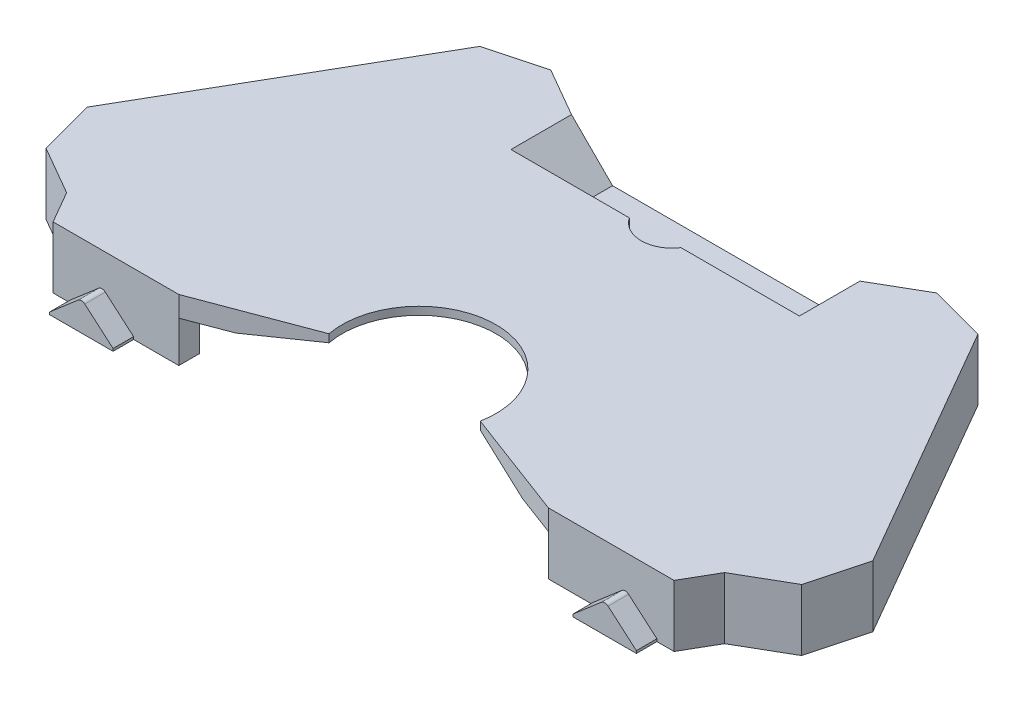
from build123d import *

# Parameters (mm, degrees)
BOSS_EXTRUDE6_DEPTH   = 2
BOSS_EXTRUDE6_2_DEPTH = 2
BOSS_EXTRUDE7_DEPTH   = 4
SKETCH15_W            = 28.094808214
SKETCH15_H            = 7.894882233
SKETCH15_R            = 1.75
BOSS_EXTRUDE8_DEPTH   = 2
BOSS_EXTRUDE9_DEPTH   = 2
FILLET3_R             = 0.5
FILLET3_OF_MIRROR2_R  = 0.5
BOSS_EXTRUDE10_DEPTH  = 2
BOSS_EXTRUDE11_DEPTH  = 4
CHAMFER2_SIZE         = 4
FILLET4_R             = 2
CHAMFER3_SIZE         = 7
CHAMFER3_SIZE2        = 1.234288865


# Some blends are built 0.0001 mm under size
with BuildPart() as part:
    # Sketch13 → Boss-Extrude6 (new body)
    with BuildSketch(Plane(origin=(0, 0, 0), x_dir=(1, 0, 0), z_dir=(0, 1, 0))):
        Polygon((-18, 21), (-14.047404107, 21), (-14.047404107, 28.894882233), (-18.803847577, 31.641016151), (-24.267949192, 30.176914536), (-38.267949192, 5.92820323), (-36.803847577, 0.464101615), (-32.047404107, -2.282032303), (-30.244289874, -5.405117767), (-30.12881982, -5.405117767), (-20, -5.405117767), (-18, -5.405117767), align=None)
    extrude(amount=BOSS_EXTRUDE6_DEPTH)



with BuildPart() as body_2:
    # Sketch13 → Boss-Extrude6 2 (new body)
    with BuildSketch(Plane(origin=(0, 0, 0), x_dir=(1, 0, 0), z_dir=(0, 1, 0))):
        Polygon((18, -5.405117767), (18, 21), (14.047404107, 21), (14.047404107, 28.894882233), (18.803847577, 31.641016151), (24.267949192, 30.176914536), (38.267949192, 5.92820323), (36.803847577, 0.464101615), (32.047404107, -2.282032303), (30.244289874, -5.405117767), (30.12881982, -5.405117767), (26.664718205, -5.405117767), (20, -5.405117767), align=None)
    extrude(amount=BOSS_EXTRUDE6_2_DEPTH)


with BuildPart() as part_1:
    add(part.part)

    add(body_2.part)  # Boss-Extrude7 merges body 2
    # Sketch14 → Boss-Extrude7 (add)
    with BuildSketch(Plane.XZ):
        Polygon((-30.244289874, 5.405117767), (-18, 5.405117767), (-18, 3.405117767), (-29.089589336, 3.405117767), (-30.583302492, 0.817930688), (-35.086408642, -1.78193886), (-36.121684822, -5.645642165), (-22.950111947, -28.459475601), (-19.086408642, -29.494751781), (-16.047404107, -27.740181695), (-16.047404107, -23), (-18, -23), (-18, -21), (-14.047404107, -21), (-14.047404107, -28.894882233), (-18.803847577, -31.641016151), (-24.267949192, -30.176914536), (-38.267949192, -5.92820323), (-36.803847577, -0.464101615), (-32.047404107, 2.282032303), align=None)
        Polygon((14.047404107, -21), (18, -21), (18, -23), (16.047404107, -23), (16.047404107, -27.740181695), (19.086408642, -29.494751781), (22.950111947, -28.459475601), (36.121684822, -5.645642165), (35.086408642, -1.78193886), (30.583302492, 0.817930688), (29.089589336, 3.405117767), (18, 3.405117767), (18, 5.405117767), (30.244289874, 5.405117767), (32.047404107, 2.282032303), (36.803847577, -0.464101615), (38.267949192, -5.92820323), (24.267949192, -30.176914536), (18.803847577, -31.641016151), (14.047404107, -28.894882233), align=None)
    extrude(amount=BOSS_EXTRUDE7_DEPTH)

    # Sketch15 → Boss-Extrude8 (add)
    with BuildSketch(Plane.XZ.offset(4)):
        with Locations((0, -24.947441117)):
            Rectangle(SKETCH15_W, SKETCH15_H)
        with Locations(Location((0, -24.644882233, 0), (0, 0, 270))):
            Circle(SKETCH15_R, mode=Mode.SUBTRACT)
    extrude(amount=-BOSS_EXTRUDE8_DEPTH)

    # Sketch16 → Boss-Extrude9 (add)
    with BuildSketch(Plane.XY.offset(5.405117767)):
        Polygon((-28.574119282, -3.76), (-28.574119282, -4), (-22.4, -4), (-22.4, -3.76), (-25.487059641, -1.104129474), align=None)
    boss_extrude9 = extrude(amount=BOSS_EXTRUDE9_DEPTH)

    # Fillet3
    fillet3_edges = [part_1.edges().sort_by_distance(p)[0] for p in [
        (-25.487059641, -1.104129474, 6.405117767),
    ]]
    fillet(fillet3_edges, radius=FILLET3_R)

    # Mirror2: Boss-Extrude9 across plane
    add(boss_extrude9.mirror(Plane(origin=(0, 0, 0), x_dir=(0, 0, 1), z_dir=(1, 0, 0))))

    # Fillet3 of Mirror2
    fillet3_of_mirror2_edges = [part_1.edges().sort_by_distance(p)[0] for p in [
        (25.487059641, -1.104129474, 6.405117767),
    ]]
    fillet(fillet3_of_mirror2_edges, radius=FILLET3_OF_MIRROR2_R)

    # Sketch17 → Boss-Extrude10 (add)
    with BuildSketch(Plane(origin=(0, 2, 0), x_dir=(1, 0, 0), z_dir=(0, 1, 0))):
        with BuildLine():
            Line((-18, -5.405117767), (-7.367200558, -1.405117767))
            ThreePointArc((-7.367200558, -1.405117767), (0, 7.5), (7.367200558, -1.405117767))
            Line((7.367200558, -1.405117767), (18, -5.405117767))
            Line((18, -5.405117767), (18, 21))
            Line((18, 21), (-18, 21))
            Line((-18, 21), (-18, -5.405117767))
        make_face()
    extrude(amount=-BOSS_EXTRUDE10_DEPTH)

    # Sketch18 → Boss-Extrude11 (add)
    with BuildSketch(Plane(origin=(0, -2, 0), x_dir=(1, 0, 0), z_dir=(0, 1, 0))):
        with BuildLine():
            Line((14.047404107, 21), (-14.047404107, 21))
            Line((-14.047404107, 21), (-14.047404107, 23))
            Line((-14.047404107, 23), (-2.508856799, 23))
            ThreePointArc((-2.508856799, 23), (0, 21.644882233), (2.508856799, 23))
            Line((2.508856799, 23), (14.047404107, 23))
            Line((14.047404107, 23), (14.047404107, 21))
        make_face()
    extrude(amount=BOSS_EXTRUDE11_DEPTH)

    # Chamfer2
    chamfer2_edges = [part_1.edges().sort_by_distance(p)[0] for p in [
        (14.047404107, -2, -25.947441117),
        (-14.047404107, -2, -25.947441117),
    ]]
    chamfer(chamfer2_edges, length=CHAMFER2_SIZE - 0.0001)  # a hair under: the kernel refuses the full size

    # Fillet4
    # the kernel refuses this fillet: 2 mm, written as the material it adds along each edge
    with BuildSketch(Plane(origin=(29.089589336, 2.886751346, 3.405117767), x_dir=(0.4999999999999999, 0, -0.8660254037844386), z_dir=(0, -1, 0))) as fillet4_piece_1_section:
        with BuildLine():
            CenterArc((FILLET4_R * 0.57735026919, -FILLET4_R), FILLET4_R, 90, 60)
            Line((-FILLET4_R * 0.288675134595, -FILLET4_R * 0.5), (0, 0))
            Line((0, 0), (FILLET4_R * 0.57735026919, 0))
        make_face()
    fillet4_piece_1 = extrude(amount=6.886751346, mode=Mode.PRIVATE)
    fillet4_piece_1 = split(fillet4_piece_1, bisect_by=Plane(origin=(28.968451808, 2, 3.195301414), z_dir=(0, -1, 0)), keep=Keep.TOP, mode=Mode.PRIVATE)
    add(fillet4_piece_1)
    with BuildSketch(Plane(origin=(-29.089589336, 2.886751346, 3.405117767), x_dir=(1, 0, 0), z_dir=(0, -1, 0))) as fillet4_piece_2_section:
        with BuildLine():
            CenterArc((FILLET4_R * 0.57735026919, -FILLET4_R), FILLET4_R, 90, 60)
            Line((-FILLET4_R * 0.288675134595, -FILLET4_R * 0.5), (0, 0))
            Line((0, 0), (FILLET4_R * 0.57735026919, 0))
        make_face()
    fillet4_piece_2 = extrude(amount=6.886751346, mode=Mode.PRIVATE)
    fillet4_piece_2 = split(fillet4_piece_2, bisect_by=Plane(origin=(-28.968451808, 2, 3.195301414), z_dir=(0, -1, 0)), keep=Keep.TOP, mode=Mode.PRIVATE)
    add(fillet4_piece_2)
    with BuildSketch(Plane(origin=(22.950111947, 2.071067812, -28.459475601), x_dir=(-0.9659258262890683, 0, -0.2588190451025206), z_dir=(0, -1, 0))) as fillet4_piece_3_section:
        with BuildLine():
            CenterArc((FILLET4_R * 0.414213562373, -FILLET4_R), FILLET4_R, 90, 45)
            Line((-FILLET4_R * 0.292893218813, -FILLET4_R * 0.292893218813), (0, 0))
            Line((0, 0), (FILLET4_R * 0.414213562373, 0))
        make_face()
    fillet4_piece_3 = extrude(amount=6.071067812, mode=Mode.PRIVATE)
    fillet4_piece_3 = split(fillet4_piece_3, bisect_by=Plane(origin=(22.870823982, 2, -28.356145514), z_dir=(0, -1, 0)), keep=Keep.TOP, mode=Mode.PRIVATE)
    add(fillet4_piece_3)
    with BuildSketch(Plane(origin=(19.086408642, 2.071067812, -29.494751781), x_dir=(-0.8660254037844382, 0, 0.500000000000001), z_dir=(0, -1, 0))) as fillet4_piece_4_section:
        with BuildLine():
            CenterArc((FILLET4_R * 0.414213562373, -FILLET4_R), FILLET4_R, 90, 45)
            Line((-FILLET4_R * 0.292893218813, -FILLET4_R * 0.292893218813), (0, 0))
            Line((0, 0), (FILLET4_R * 0.414213562373, 0))
        make_face()
    fillet4_piece_4 = extrude(amount=6.071067812, mode=Mode.PRIVATE)
    fillet4_piece_4 = split(fillet4_piece_4, bisect_by=Plane(origin=(19.10340899, 2, -29.365621318), z_dir=(0, -1, 0)), keep=Keep.TOP, mode=Mode.PRIVATE)
    add(fillet4_piece_4)
    with BuildSketch(Plane(origin=(16.047404107, 2.886751346, -27.740181695), x_dir=(0, 0, 1), z_dir=(0, -1, 0))) as fillet4_piece_5_section:
        with BuildLine():
            CenterArc((FILLET4_R * 0.57735026919, -FILLET4_R), FILLET4_R, 90, 60)
            Line((-FILLET4_R * 0.288675134595, -FILLET4_R * 0.5), (0, 0))
            Line((0, 0), (FILLET4_R * 0.57735026919, 0))
        make_face()
    fillet4_piece_5 = extrude(amount=6.886751346, mode=Mode.PRIVATE)
    fillet4_piece_5 = split(fillet4_piece_5, bisect_by=Plane(origin=(16.257220459, 2, -27.619044168), z_dir=(0, -1, 0)), keep=Keep.TOP, mode=Mode.PRIVATE)
    add(fillet4_piece_5)
    with BuildSketch(Plane(origin=(-22.950111947, 2.071067812, -28.459475601), x_dir=(-0.500000000000001, 0, 0.8660254037844382), z_dir=(0, -1, 0))) as fillet4_piece_6_section:
        with BuildLine():
            CenterArc((FILLET4_R * 0.414213562373, -FILLET4_R), FILLET4_R, 90, 45)
            Line((-FILLET4_R * 0.292893218813, -FILLET4_R * 0.292893218813), (0, 0))
            Line((0, 0), (FILLET4_R * 0.414213562373, 0))
        make_face()
    fillet4_piece_6 = extrude(amount=6.071067812, mode=Mode.PRIVATE)
    fillet4_piece_6 = split(fillet4_piece_6, bisect_by=Plane(origin=(-22.870823982, 2, -28.356145514), z_dir=(0, -1, 0)), keep=Keep.TOP, mode=Mode.PRIVATE)
    add(fillet4_piece_6)
    with BuildSketch(Plane(origin=(-19.086408642, 2.071067812, -29.494751781), x_dir=(-0.9659258262890694, 0, 0.2588190451025166), z_dir=(0, -1, 0))) as fillet4_piece_7_section:
        with BuildLine():
            CenterArc((FILLET4_R * 0.414213562373, -FILLET4_R), FILLET4_R, 90, 45)
            Line((-FILLET4_R * 0.292893218813, -FILLET4_R * 0.292893218813), (0, 0))
            Line((0, 0), (FILLET4_R * 0.414213562373, 0))
        make_face()
    fillet4_piece_7 = extrude(amount=6.071067812, mode=Mode.PRIVATE)
    fillet4_piece_7 = split(fillet4_piece_7, bisect_by=Plane(origin=(-19.10340899, 2, -29.365621318), z_dir=(0, -1, 0)), keep=Keep.TOP, mode=Mode.PRIVATE)
    add(fillet4_piece_7)
    with BuildSketch(Plane(origin=(-16.047404107, 2.886751346, -27.740181695), x_dir=(-0.8660254037844385, 0, -0.5000000000000003), z_dir=(0, -1, 0))) as fillet4_piece_8_section:
        with BuildLine():
            CenterArc((FILLET4_R * 0.57735026919, -FILLET4_R), FILLET4_R, 90, 60)
            Line((-FILLET4_R * 0.288675134595, -FILLET4_R * 0.5), (0, 0))
            Line((0, 0), (FILLET4_R * 0.57735026919, 0))
        make_face()
    fillet4_piece_8 = extrude(amount=6.886751346, mode=Mode.PRIVATE)
    fillet4_piece_8 = split(fillet4_piece_8, bisect_by=Plane(origin=(-16.257220459, 2, -27.619044168), z_dir=(0, -1, 0)), keep=Keep.TOP, mode=Mode.PRIVATE)
    add(fillet4_piece_8)
    with BuildSketch(Plane(origin=(-16.047404107, 5, -23), x_dir=(0, 0, -1), z_dir=(0, -1, 0))) as fillet4_piece_9_section:
        with BuildLine():
            CenterArc((FILLET4_R, -FILLET4_R), FILLET4_R, 90, 90)
            Line((0, -FILLET4_R), (0, 0))
            Line((0, 0), (FILLET4_R, 0))
        make_face()
    fillet4_piece_9 = extrude(amount=9, mode=Mode.PRIVATE)
    fillet4_piece_9 = split(fillet4_piece_9, bisect_by=Plane(origin=(-18, -2, -23.446740496), z_dir=(1, 0, 0)), keep=Keep.TOP, mode=Mode.PRIVATE)
    fillet4_piece_9 = split(fillet4_piece_9, bisect_by=Plane(origin=(-16.494124288, 2, -23.446740496), z_dir=(0, -1, 0)), keep=Keep.TOP, mode=Mode.PRIVATE)
    add(fillet4_piece_9)
    with BuildSketch(Plane(origin=(16.047404107, 5, -23), x_dir=(1, 0, 0), z_dir=(0, -1, 0))) as fillet4_piece_10_section:
        with BuildLine():
            CenterArc((FILLET4_R, -FILLET4_R), FILLET4_R, 90, 90)
            Line((0, -FILLET4_R), (0, 0))
            Line((0, 0), (FILLET4_R, 0))
        make_face()
    fillet4_piece_10 = extrude(amount=9, mode=Mode.PRIVATE)
    fillet4_piece_10 = split(fillet4_piece_10, bisect_by=Plane(origin=(18, -2, -23.446740496), z_dir=(-1, 0, 0)), keep=Keep.TOP, mode=Mode.PRIVATE)
    fillet4_piece_10 = split(fillet4_piece_10, bisect_by=Plane(origin=(16.494124288, 2, -23.446740496), z_dir=(0, -1, 0)), keep=Keep.TOP, mode=Mode.PRIVATE)
    add(fillet4_piece_10)
    # the kernel refuses this fillet: 2 mm, written as the material it takes off along each edge
    with BuildSketch(Plane(origin=(30.583302492, 0, 0.817930688), x_dir=(0.8660254037844376, 0, -0.500000000000002), z_dir=(0, -1, 0)), Plane(origin=(-30.583302492, 0, 0.817930688), x_dir=(0.5000000000000039, 0, 0.8660254037844364), z_dir=(0, -1, 0))) as fillet4_2_piece_1:
        with BuildLine():
            CenterArc((FILLET4_R * 0.267949192431, FILLET4_R), FILLET4_R, 240, 30)
            Line((-FILLET4_R * 0.232050807569, FILLET4_R * 0.133974596216), (0, 0))
            Line((0, 0), (FILLET4_R * 0.267949192431, 0))
        make_face()
    extrude(amount=5.339745962, mode=Mode.SUBTRACT)

    # Chamfer3
    chamfer3_edges = [part_1.edges().sort_by_distance(p)[0] for p in [
        (0, 0, -7.5),
    ]]
    chamfer3_side = [part_1.faces().sort_by_distance(p)[0] for p in [
        (0, 0, -10.489967156),
    ]]
    chamfer(chamfer3_edges, length=CHAMFER3_SIZE, length2=CHAMFER3_SIZE2, reference=chamfer3_side[0])


solid = part_1.part
